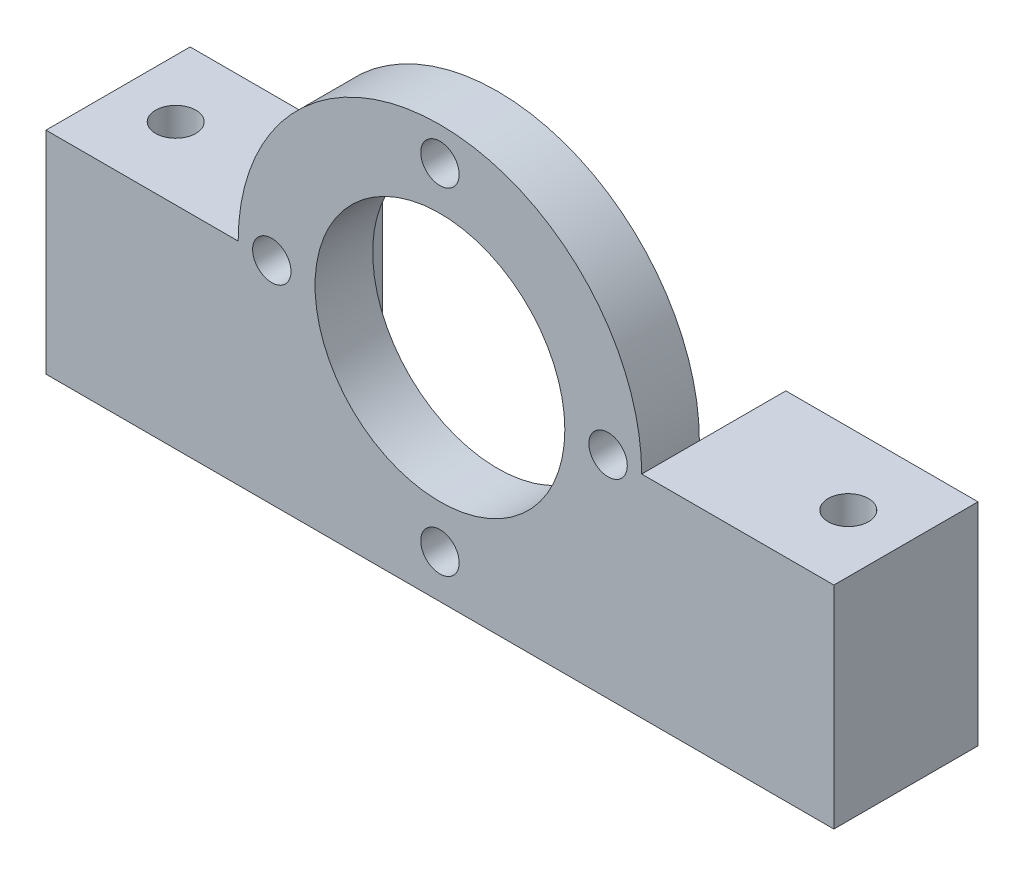
from build123d import *

# Parameters (mm, degrees)
SKETCH_1_R          = 13
SKETCH_1_R_2        = 2
EXTRUDE_1_DEPTH     = 6
SKETCH_2_W          = 20
SKETCH_2_H          = 22
EXTRUDE_2_DEPTH     = 15
SKETCH_3_R          = 2.1
CUT_EXTRUDE_1_DEPTH = 48.391982444


with BuildPart() as part:
    # 草图1 → 凸台-拉伸1 (new body)
    with BuildSketch(Plane.XY):
        with BuildLine():
            Line((-21, 22), (-21, 0))
            Line((-21, 0), (21, 0))
            Line((21, 0), (21, 22))
            ThreePointArc((21, 22), (0, 43), (-21, 22))
        make_face()
        with Locations((0, 22)):
            Circle(SKETCH_1_R, mode=Mode.SUBTRACT)
        with Locations((0, 39.5)):
            Circle(SKETCH_1_R_2, mode=Mode.SUBTRACT)
        with Locations((17.5, 22)):
            Circle(SKETCH_1_R_2, mode=Mode.SUBTRACT)
        with Locations((0, 4.5)):
            Circle(SKETCH_1_R_2, mode=Mode.SUBTRACT)
        with Locations((-17.5, 22)):
            Circle(SKETCH_1_R_2, mode=Mode.SUBTRACT)
    extrude(amount=EXTRUDE_1_DEPTH)

    # 草图2 → 凸台-拉伸2 (add)
    with BuildSketch(Plane.XY.offset(6)):
        with Locations((-31, 11)):
            Rectangle(SKETCH_2_W, SKETCH_2_H)
        with Locations((31, 11)):
            Rectangle(SKETCH_2_W, SKETCH_2_H)
    extrude(amount=-EXTRUDE_2_DEPTH)

    # 草图3 → 切除-拉伸1 (cut, through all)
    with BuildSketch(Plane(origin=(0, 22, 0), x_dir=(1, 0, 0), z_dir=(0, 1, 0))):
        with Locations((-35, 1.5)):
            Circle(SKETCH_3_R)
        with Locations((35, 1.5)):
            Circle(SKETCH_3_R)
    extrude(amount=-CUT_EXTRUDE_1_DEPTH, mode=Mode.SUBTRACT)


solid = part.part
